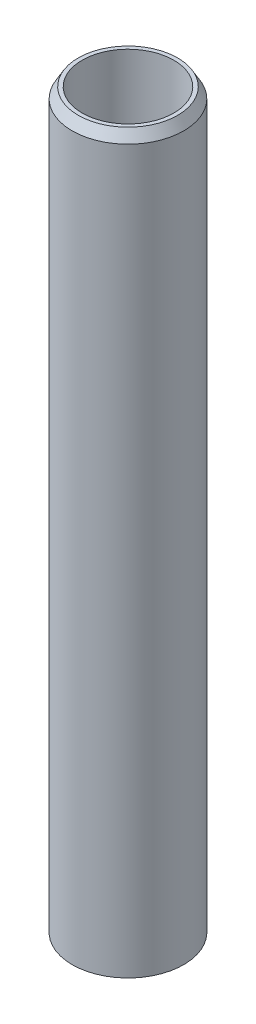
from build123d import *

# Parameters (mm, degrees)
SKETCH1_R           = 25
BOSS_EXTRUDE1_DEPTH = 331.060461
SKETCH2_R           = 20.541414044
CUT_EXTRUDE1_DEPTH  = 333.942981361
CHAMFER1_SIZE       = 4.690328
CHAMFER1_SIZE_2     = 2.707962


with BuildPart() as part:
    # Sketch1 → Boss-Extrude1 (new body)
    with BuildSketch(Plane(origin=(0, 0, 0), x_dir=(1, 0, 0), z_dir=(0, 1, 0))):
        with Locations(Location((0, 0, 0), (0, 0, 270))):
            Circle(SKETCH1_R)
    extrude(amount=BOSS_EXTRUDE1_DEPTH)

    # Sketch2 → Cut-Extrude1 (cut, through all)
    with BuildSketch(Plane(origin=(0, 0, 0), x_dir=(1, 0, 0), z_dir=(0, 1, 0))):
        with Locations(Location((0, 0, 0), (0, 0, 270))):
            Circle(SKETCH2_R)
    extrude(amount=CUT_EXTRUDE1_DEPTH, mode=Mode.SUBTRACT)

    # Chamfer1
    # the kernel refuses this chamfer: 4.690328, 2.707962 mm, written as the material it takes off along each edge
    with BuildSketch(Plane(origin=(0, 331.060461, 0), x_dir=(0, 0, 1), z_dir=(-1, 0, 0))) as chamfer1_piece_1:
        Polygon((25, -CHAMFER1_SIZE), (25 - CHAMFER1_SIZE_2, 0), (25, 0), align=None)
    revolve(axis=Axis((0, 331.060461, 0), (0, 1, 0)), mode=Mode.SUBTRACT)
    with BuildSketch(Plane(origin=(0, 0, 0), x_dir=(0, 0, 1), z_dir=(-1, 0, 0))) as chamfer1_piece_2:
        Polygon((25, CHAMFER1_SIZE_2), (25 - CHAMFER1_SIZE, 0), (25, 0), align=None)
    revolve(axis=Axis((0, 0, 0), (0, 1, 0)), mode=Mode.SUBTRACT)


solid = part.part
